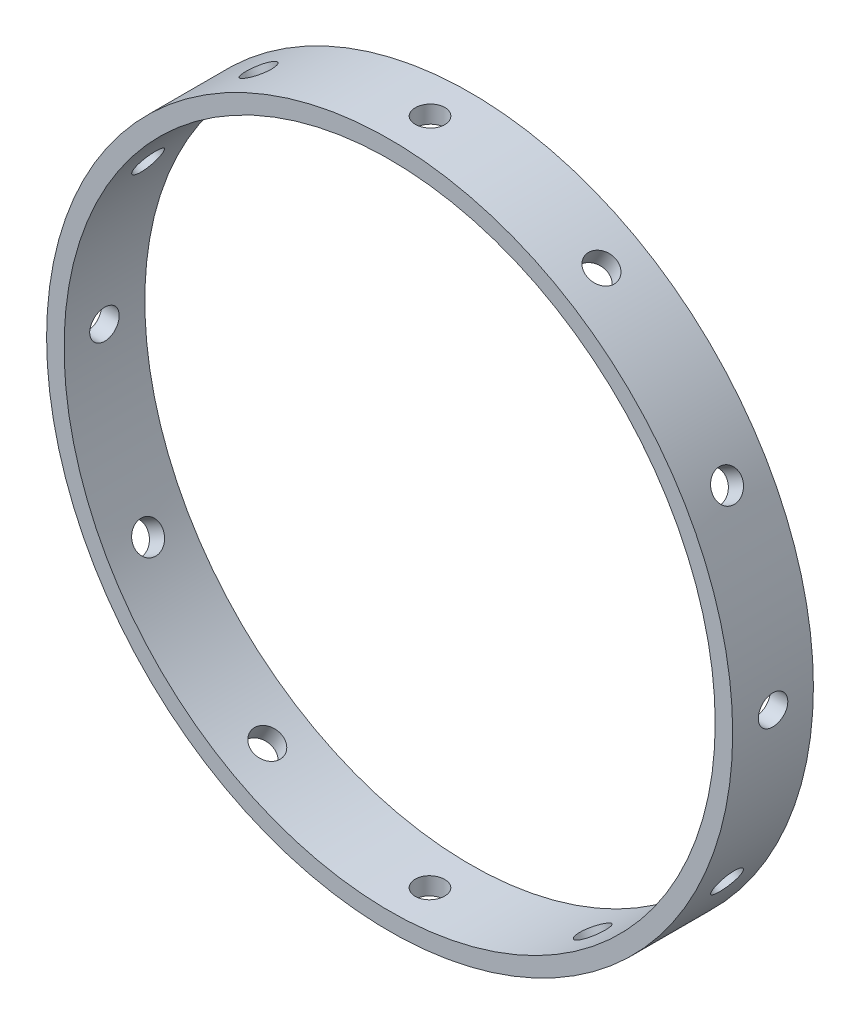
from build123d import *

# Parameters (mm, degrees)
SKETCH1_R           = 80.9625
SKETCH1_R_2         = 76.835
BOSS_EXTRUDE1_DEPTH = 19.05
SKETCH2_R           = 3.478244762
CUT_EXTRUDE1_DEPTH  = 117.072198706
CIRPATTERN1_COUNT   = 12


with BuildPart() as part:
    # Sketch1 → Boss-Extrude1 (new body)
    with BuildSketch(Plane.XY):
        Circle(SKETCH1_R)
        Circle(SKETCH1_R_2, mode=Mode.SUBTRACT)
    extrude(amount=BOSS_EXTRUDE1_DEPTH)

    # Sketch2 → Cut-Extrude1 (cut, through all)
    with BuildSketch(Plane(origin=(0, 0, 0), x_dir=(1, 0, 0), z_dir=(0, 1, 0))):
        with Locations((0, -9.525)):
            Circle(SKETCH2_R)
    cut_extrude1 = extrude(amount=-CUT_EXTRUDE1_DEPTH, mode=Mode.SUBTRACT)

    # CirPattern1: Cut-Extrude1 ×12 about axis
    cirpattern1_axis = Axis((0, 0, 2.080715754), (0, 0, 1))
    for i in range(1, CIRPATTERN1_COUNT):
        add(cut_extrude1.rotate(cirpattern1_axis, i * 360 / CIRPATTERN1_COUNT), mode=Mode.SUBTRACT)


solid = part.part
